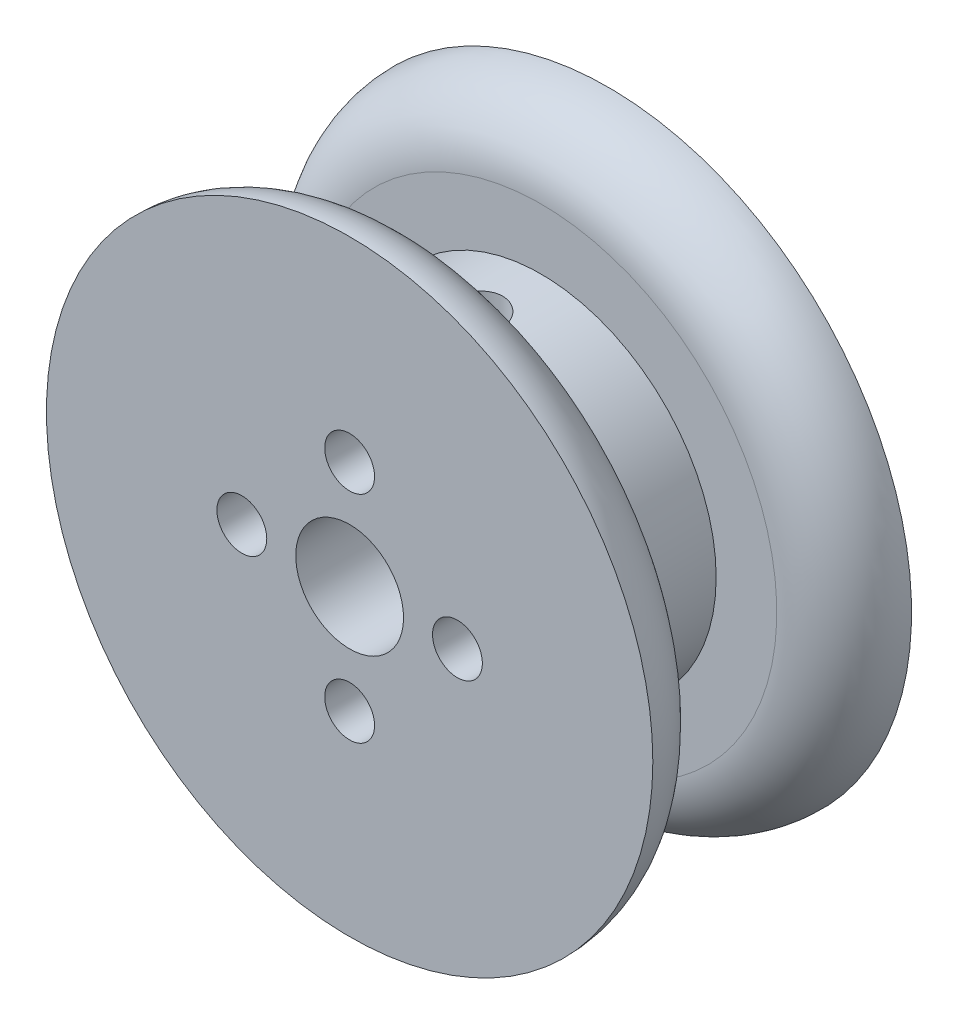
from build123d import *

# Parameters (mm, degrees)
SKETCH1_R               = 22.5
BOSS_EXTRUDE1_DEPTH     = 5
SKETCH2_R               = 13
BOSS_EXTRUDE2_DEPTH     = 9.2
BOSS_EXTRUDE4_START     = 5
SKETCH5_R               = 22.5
BOSS_EXTRUDE4_DEPTH     = 5
SKETCH6_R               = 4
SKETCH6_R_2             = 1.85
CUT_EXTRUDE1_DEPTH      = 38.163691959
FILLET1_R               = 5
CUT_EXTRUDE2_DEPTH      = 26
CUT_EXTRUDE2_DEPTH_BACK = 26
SKETCH8_R               = 1.85


with BuildPart() as part:
    # Sketch1 → Boss-Extrude1 (new body)
    with BuildSketch(Plane.XY):
        Circle(SKETCH1_R)
    extrude(amount=BOSS_EXTRUDE1_DEPTH)

    # Sketch2 → Boss-Extrude2 (add)
    with BuildSketch(Plane.XY):
        Circle(SKETCH2_R)
    extrude(amount=-BOSS_EXTRUDE2_DEPTH)

    # Sketch5 → Boss-Extrude4 (add)
    with BuildSketch(Plane(origin=(0, 0, -9.2), x_dir=(-1, 0, 0), z_dir=(0, 0, -1)).offset(BOSS_EXTRUDE4_START)):
        with Locations(Location((0, 0, 0), (0, 0, 180))):
            Circle(SKETCH5_R)
    extrude(amount=-BOSS_EXTRUDE4_DEPTH)

    # Sketch6 → Cut-Extrude1 (cut, through all)
    with BuildSketch(Plane.XY.offset(5)):
        Circle(SKETCH6_R)
        with Locations((0, 8)):
            Circle(SKETCH6_R_2)
        with Locations((8, 0)):
            Circle(SKETCH6_R_2)
        with Locations((0, -8)):
            Circle(SKETCH6_R_2)
        with Locations((-8, 0)):
            Circle(SKETCH6_R_2)
    extrude(amount=-CUT_EXTRUDE1_DEPTH, mode=Mode.SUBTRACT)

    # Fillet1
    fillet1_edges = [part.edges().sort_by_distance(p)[0] for p in [
        (-22.5, 0, 0),
        (-22.5, 0, -9.2),
    ]]
    fillet(fillet1_edges, radius=FILLET1_R - 0.0001)  # a hair under: the kernel refuses the full size

    # Sketch8 → Cut-Extrude2 (cut, two sides: drawn at the far end of the back side and taken through both)
    with BuildSketch(Plane(origin=(0, 0, 0), x_dir=(1, 0, 0), z_dir=(0, 1, 0)).offset(-CUT_EXTRUDE2_DEPTH_BACK)):
        with Locations(Location((0, 4.5, 0), (0, 0, 90))):
            Circle(SKETCH8_R)
    extrude(amount=CUT_EXTRUDE2_DEPTH + CUT_EXTRUDE2_DEPTH_BACK, mode=Mode.SUBTRACT)


solid = part.part
